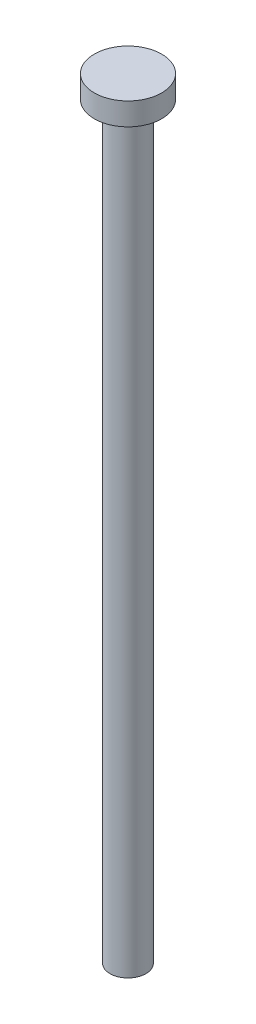
from build123d import *

# Parameters (mm, degrees)
CROQUIS1_R              = 2.4
SALIENTE_EXTRUIR1_DEPTH = 50
CROQUIS2_R              = 4.5
SALIENTE_EXTRUIR2_DEPTH = 3


with BuildPart() as part:
    # Croquis1 → Saliente-Extruir1 (new, symmetric)
    with BuildSketch(Plane(origin=(0, 0, 0), x_dir=(1, 0, 0), z_dir=(0, 1, 0))):
        Circle(CROQUIS1_R)
    extrude(amount=SALIENTE_EXTRUIR1_DEPTH, both=True)

    # Croquis2 → Saliente-Extruir2 (add)
    with BuildSketch(Plane(origin=(0, 50, 0), x_dir=(1, 0, 0), z_dir=(0, 1, 0))):
        Circle(CROQUIS2_R)
    extrude(amount=SALIENTE_EXTRUIR2_DEPTH)


solid = part.part
